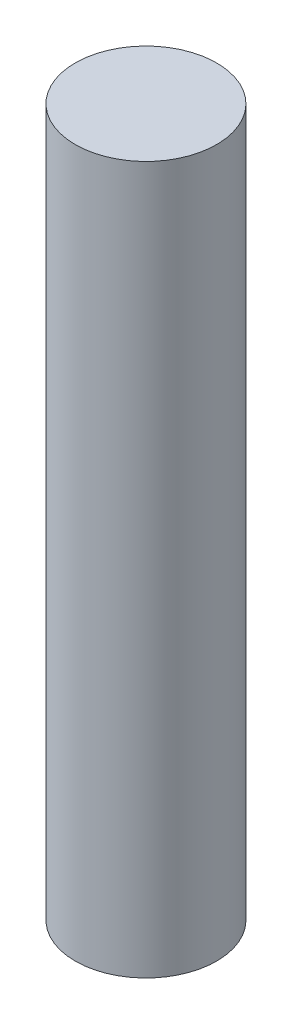
from build123d import *

# Parameters (mm, degrees)
SKETCH1_R           = 1.5
BOSS_EXTRUDE1_DEPTH = 7.5


with BuildPart() as part:
    # Sketch1 → Boss-Extrude1 (new, symmetric)
    with BuildSketch(Plane(origin=(0, 0, 0), x_dir=(1, 0, 0), z_dir=(0, 1, 0))):
        Circle(SKETCH1_R)
    extrude(amount=BOSS_EXTRUDE1_DEPTH, both=True)


solid = part.part
